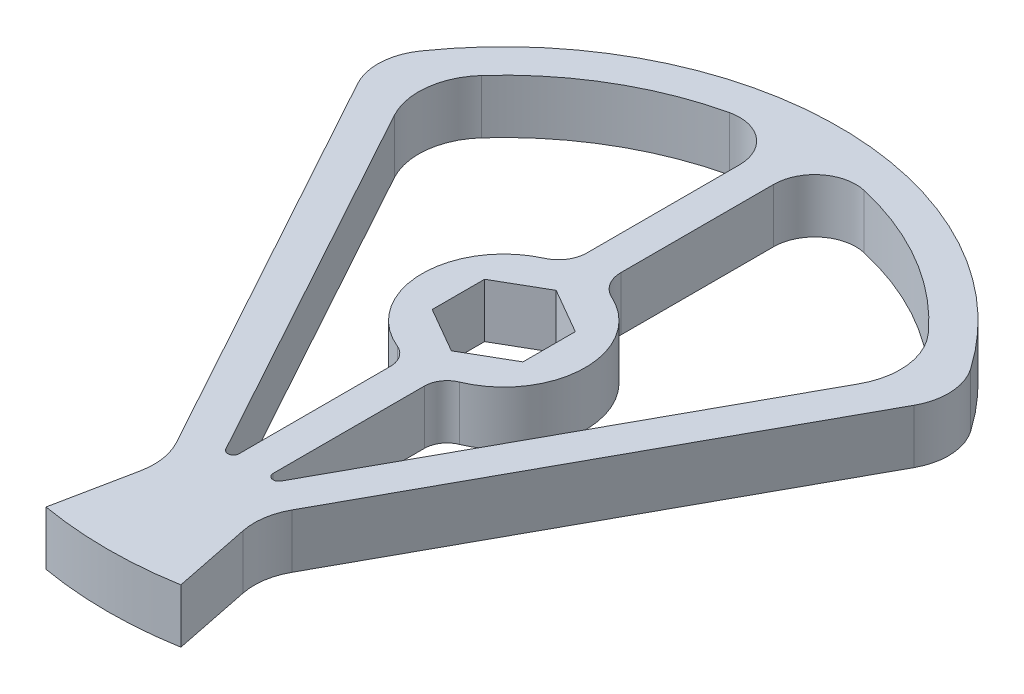
from build123d import *

# Parameters (mm, degrees)
BOSS_EXTRUDE5_DEPTH = 9.525
FILLET8_R           = 5
FILLET9_R           = 7.25
FILLET10_R          = 4
FILLET11_R          = 1
FILLET14_R          = 12
FILLET15_R          = 10
FILLET16_R          = 11


with BuildPart() as part:
    # Sketch1 → Boss-Extrude5 (new body)
    with BuildSketch(Plane(origin=(0, 0, 0), x_dir=(1, 0, 0), z_dir=(0, 1, 0))):
        with BuildLine():
            Line((-51.875429942, 28.415657517), (-8.291005472, -51.038958984))
            Line((-8.291005472, -51.038958984), (-11.89239606, -68.83017809))
            ThreePointArc((-11.89239606, -68.83017809), (0, -69.85), (11.892396059, -68.83017809))
            Line((11.892396059, -68.83017809), (8.309715279, -51.131387248))
            Line((8.309715279, -51.131387248), (51.9100856, 28.352298616))
            ThreePointArc((51.9100856, 28.352298616), (0.036108742, 59.148191181), (-51.875429942, 28.415657517))
        make_face()
        with BuildLine():
            Line((-3, -47.56496159), (-44.710719117, 28.473880993))
            ThreePointArc((-44.710719117, 28.473880993), (-26.805114271, 45.730691572), (-3, 52.922682309))
            Line((-3, 52.922682309), (-3, 14.060422932))
            ThreePointArc((-3, 14.060422932), (-14.376908326, 0), (-3, -14.060422932))
            Line((-3, -14.060422932), (-3, -47.56496159))
        make_face(mode=Mode.SUBTRACT)
        Polygon((-1.274265514, 8.50190677), (0, 9.237604307), (4.725734486, 6.509200229), (5.08, 6.30466494), (8, 4.618802154), (8, -4.618802154), (5.08, -6.30466494), (0, -9.237604307), (-7, -5.196152423), (-8, -4.618802154), (-8, 4.618802154), (-3.624265514, 7.145133637), align=None, mode=Mode.SUBTRACT)
        with BuildLine():
            ThreePointArc((3, 52.922682309), (26.805114271, 45.730691572), (44.710719117, 28.473880993))
            Line((44.710719117, 28.473880993), (3, -47.56496159))
            Line((3, -47.56496159), (3, -14.060422932))
            ThreePointArc((3, -14.060422932), (14.376908326, 0), (3, 14.060422932))
            Line((3, 14.060422932), (3, 52.922682309))
        make_face(mode=Mode.SUBTRACT)
    extrude(amount=BOSS_EXTRUDE5_DEPTH)

    # Fillet8
    fillet8_edges = [part.edges().sort_by_distance(p)[0] for p in [
        (-3, 4.7625, -14.060422932),
        (3, 4.7625, -14.060422932),
    ]]
    fillet(fillet8_edges, radius=FILLET8_R)

    # Fillet9
    fillet9_edges = [part.edges().sort_by_distance(p)[0] for p in [
        (-3, 4.7625, -52.922682309),
        (3, 4.7625, -52.922682309),
    ]]
    fillet(fillet9_edges, radius=FILLET9_R)

    # Fillet10
    fillet10_edges = [part.edges().sort_by_distance(p)[0] for p in [
        (-3, 4.7625, 14.060422932),
        (3, 4.7625, 14.060422932),
    ]]
    fillet(fillet10_edges, radius=FILLET10_R)

    # Fillet11
    fillet11_edges = [part.edges().sort_by_distance(p)[0] for p in [
        (-3, 4.7625, 47.56496159),
        (3, 4.7625, 47.56496159),
    ]]
    fillet(fillet11_edges, radius=FILLET11_R)

    # Fillet14
    fillet14_edges = [part.edges().sort_by_distance(p)[0] for p in [
        (44.710719117, 4.7625, -28.473880993),
        (-44.710719117, 4.7625, -28.473880993),
    ]]
    fillet(fillet14_edges, radius=FILLET14_R)

    # Fillet15
    fillet15_edges = [part.edges().sort_by_distance(p)[0] for p in [
        (51.9100856, 4.7625, -28.352298616),
        (-51.875429942, 4.7625, -28.415657517),
    ]]
    fillet(fillet15_edges, radius=FILLET15_R)

    # Fillet16
    fillet16_edges = [part.edges().sort_by_distance(p)[0] for p in [
        (-8.291005472, 4.7625, 51.038958984),
        (8.309715279, 4.7625, 51.131387248),
    ]]
    fillet(fillet16_edges, radius=FILLET16_R)


solid = part.part
